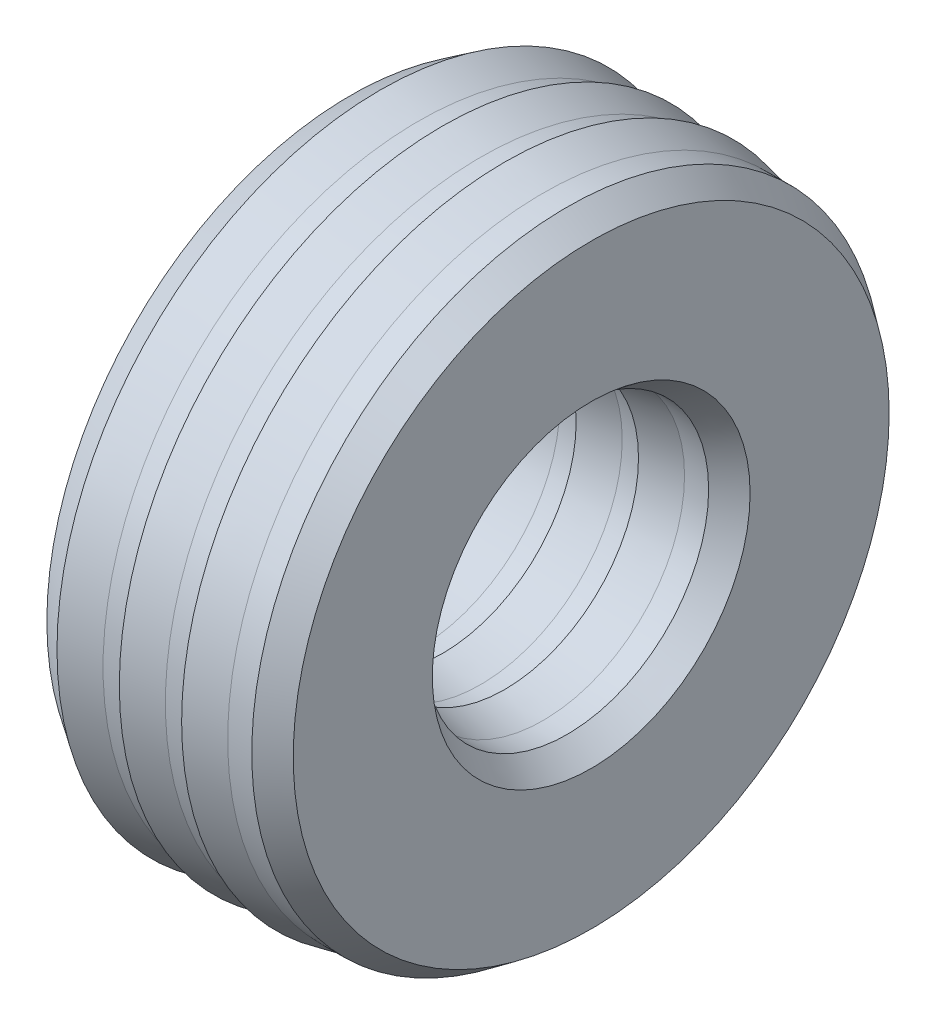
from build123d import *

# Parameters (mm, degrees)
SKETCH10_R        = 0.127
CIRPATTERN2_COUNT = 4


with BuildPart() as part:
    # Sketch7 → Revolve1 (revolve)
    with BuildSketch(Plane.XY, mode=Mode.PRIVATE) as revolve1_sk:
        Polygon((-0.9271, 2.741295), (-0.6223, 2.741295), (-0.6223, 2.9591), (0.6223, 2.9591), (0.6223, 1.7145), (-0.6223, 1.7145), (-0.6223, 1.932305), (-0.9271, 1.932305), (-1.2319, 1.81117875), (-1.2319, 1.56892625), (-0.9271, 1.36779), (-0.53594, 1.4478), (-0.28956, 1.4478), (-0.28956, 1.36779), (0.1016, 1.4478), (0.34798, 1.4478), (0.34798, 1.36779), (0.73914, 1.4478), (0.98552, 1.4478), (1.2319, 1.6256), (1.2319, 3.048), (0.98552, 3.2258), (0.73914, 3.2258), (0.34798, 3.30581), (0.34798, 3.2258), (0.1016, 3.2258), (-0.28956, 3.30581), (-0.28956, 3.2258), (-0.53594, 3.2258), (-0.9271, 3.30581), (-1.2319, 3.10467375), (-1.2319, 2.86242125), align=None)
    revolve(revolve1_sk.sketch.rotate(Axis((0, 0, 0), (1, 0, 0)), 270), axis=Axis((0, 0, 0), (1, 0, 0)))


with BuildPart() as body_2:
    # Sweep2: sweep along a curve in space
    with BuildLine() as sweep2_path:
        add(Edge.make_bspline(
            [(0, 1.391939699, 1.391939699), (0.146419104, 1.415061506, 1.368817893), (0.28491698, 1.503998545, 1.411418249), (0.395612683, 1.750361832, 1.537531149), (0.362696922, 1.901913538, 1.615348012), (0.158157933, 2.114002604, 1.679311118), (-0.007320774, 2.168919214, 1.662464778), (-0.274563842, 2.132193365, 1.526129746), (-0.3683, 2.042292862, 1.409965275), (-0.3683, 1.844229893, 1.185699926), (-0.274563841, 1.74341027, 1.082502781), (-0.007320776, 1.682034864, 0.969553834), (0.158157934, 1.725217023, 0.960137453), (0.362696921, 1.937650541, 0.996567289), (0.395612683, 2.101983799, 1.038369124), (0.28491698, 2.378251732, 1.079251562), (0.144630907, 2.482521958, 1.075458036), (-0.144630907, 2.516378837, 0.993661314), (-0.28491698, 2.445289488, 0.917291434), (-0.395612683, 2.220938532, 0.750984277), (-0.362696921, 2.075130822, 0.664429578), (-0.158157934, 1.899086203, 0.540099906), (0.007320776, 1.875186807, 0.502939759), (0.274563841, 1.998422031, 0.466475155), (0.3683, 2.14267484, 0.464767797), (0.3683, 2.441280239, 0.44621672), (0.274563842, 2.586972673, 0.427652684), (0.007320774, 2.70930211, 0.357317301), (-0.158157933, 2.682357737, 0.306663822), (-0.362696922, 2.487118534, 0.202135079), (-0.395612683, 2.324914701, 0.150113562), (-0.28491698, 2.061515103, 0.065287432), (-0.144630906, 1.9685, 0.03220949), (0.144630906, 1.9685, -0.03220949), (0.28491698, 2.061515103, -0.065287432), (0.395612683, 2.324914701, -0.150113562), (0.362696922, 2.487118534, -0.202135079), (0.158157933, 2.682357737, -0.306663822), (-0.007320774, 2.70930211, -0.357317301), (-0.274563842, 2.586972673, -0.427652684), (-0.3683, 2.441280239, -0.44621672), (-0.3683, 2.14267484, -0.464767797), (-0.274563841, 1.998422031, -0.466475155), (-0.007320776, 1.875186807, -0.502939759), (0.158157934, 1.899086203, -0.540099906), (0.362696921, 2.075130822, -0.664429578), (0.395612683, 2.220938532, -0.750984277), (0.28491698, 2.445289488, -0.917291434), (0.144630907, 2.516378837, -0.993661314), (-0.144630907, 2.482521958, -1.075458036), (-0.28491698, 2.378251732, -1.079251562), (-0.395612683, 2.101983799, -1.038369124), (-0.362696921, 1.937650541, -0.996567289), (-0.158157934, 1.725217023, -0.960137453), (0.007320776, 1.682034864, -0.969553834), (0.274563841, 1.74341027, -1.082502781), (0.3683, 1.844229893, -1.185699926), (0.3683, 2.042292862, -1.409965275), (0.274563842, 2.132193365, -1.526129746), (0.007320774, 2.168919214, -1.662464778), (-0.158157933, 2.114002604, -1.679311118), (-0.362696922, 1.901913538, -1.615348012), (-0.395612683, 1.750361832, -1.537531149), (-0.28491698, 1.503998545, -1.411418249), (-0.146419104, 1.415061506, -1.368817893), (0, 1.391939699, -1.391939699)],
            knots=[0, 0, 0, 0, 0.03125, 0.03125, 0.0625, 0.0625, 0.09375, 0.09375, 0.125, 0.125, 0.15625, 0.15625, 0.1875, 0.1875, 0.21875, 0.21875, 0.25, 0.25, 0.28125, 0.28125, 0.3125, 0.3125, 0.34375, 0.34375, 0.375, 0.375, 0.40625, 0.40625, 0.4375, 0.4375, 0.46875, 0.46875, 0.5, 0.5, 0.53125, 0.53125, 0.5625, 0.5625, 0.59375, 0.59375, 0.625, 0.625, 0.65625, 0.65625, 0.6875, 0.6875, 0.71875, 0.71875, 0.75, 0.75, 0.78125, 0.78125, 0.8125, 0.8125, 0.84375, 0.84375, 0.875, 0.875, 0.90625, 0.90625, 0.9375, 0.9375, 0.96875, 0.96875, 1, 1, 1, 1], degree=3))
    # Sketch10 → Sweep2 (sweep)
    with BuildSketch(Plane(origin=(0, 0, 0), x_dir=(0, 0, -1), z_dir=(1, 0, 0))):
        with Locations((-1.302137138, 1.302137138)):
            Circle(SKETCH10_R)
    sweep(path=sweep2_path.line, is_frenet=True)


with BuildPart() as cirpattern2_1:
    # CirPattern2: pattern copy
    add(body_2.part.rotate(Axis((-1.35509, 0, 0), (1, 0, 0)), 1 * 360 / CIRPATTERN2_COUNT))


with BuildPart() as cirpattern2_2:
    # CirPattern2: pattern copy
    add(body_2.part.rotate(Axis((-1.35509, 0, 0), (1, 0, 0)), 2 * 360 / CIRPATTERN2_COUNT))


with BuildPart() as cirpattern2_3:
    # CirPattern2: pattern copy
    add(body_2.part.rotate(Axis((-1.35509, 0, 0), (1, 0, 0)), 3 * 360 / CIRPATTERN2_COUNT))


solid = Compound([part.part, body_2.part, cirpattern2_1.part, cirpattern2_2.part, cirpattern2_3.part])
